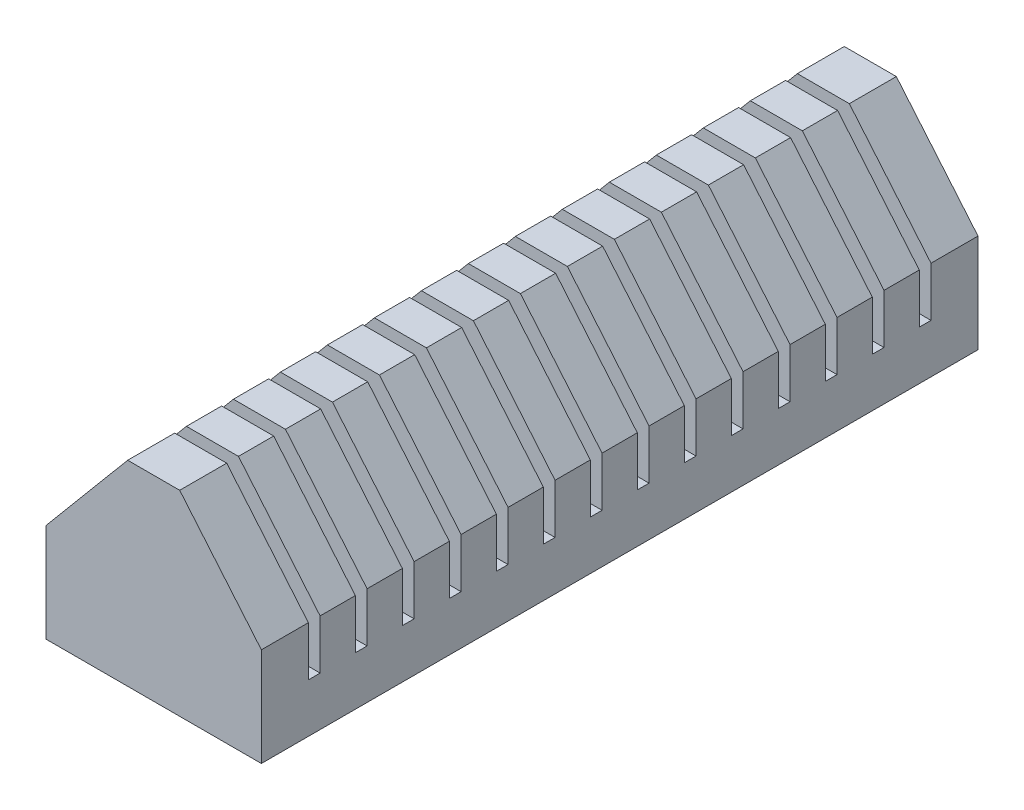
from build123d import *

# Parameters (mm, degrees)
AUFSATZ_LINEAR_AUSTRAGEN2_DEPTH      = 1.8
SCHNITT_LINEAR_AUSTRAGEN1_DEPTH      = 0.5
SCHNITT_LINEAR_AUSTRAGEN2_DEPTH      = 21.328305389
SKIZZE6_W                            = 22
SKIZZE6_H                            = 5
AUFSATZ_LINEAR_AUSTRAGEN3_DEPTH      = 1.2
LINEARES_MUSTER1_COUNT               = 15
LINEARES_MUSTER1_PITCH               = 4.8
AUFSATZ_LINEAR_AUSTRAGEN4_DEPTH      = 1.2
AUFSATZ_LINEAR_AUSTRAGEN4_DEPTH_BACK = 1.3
AUFSATZ_LINEAR_AUSTRAGEN5_DEPTH      = 1.2
AUFSATZ_LINEAR_AUSTRAGEN5_DEPTH_BACK = 0.8
AUFSATZ_LINEAR_START                 = -2.5
AUFSATZ_LINEAR_AUSTRAGEN7_DEPTH      = 2.5


with BuildPart() as part:
    # Skizze3 → Aufsatz-Linear austragen2 (new, symmetric)
    with BuildSketch(Plane.XY):
        Polygon((-11, -3), (-11, 7.057881962), (-2.657572421, 17), (2.657572421, 17), (11, 7.057881962), (11, -3), align=None)
    aufsatz_linear_austragen2 = extrude(amount=AUFSATZ_LINEAR_AUSTRAGEN2_DEPTH, both=True)

    # Skizze2 → Schnitt-Linear austragen1 (cut, symmetric)
    with BuildSketch(Plane.XY):
        Polygon((-8, 0), (8, 0), (8, 5.965971259), (0, 15.5), (-8, 5.965971259), align=None)
    schnitt_linear_austragen1 = extrude(amount=SCHNITT_LINEAR_AUSTRAGEN1_DEPTH, both=True, mode=Mode.SUBTRACT)

    # Skizze5 → Schnitt-Linear austragen2 (cut, symmetric)
    with BuildSketch(Plane.XY):
        Polygon((-0.75, 0), (0, 0.893815194), (0.75, 0), (0.75, -1.5), (-0.75, -1.5), align=None)
    schnitt_linear_austragen2 = extrude(amount=SCHNITT_LINEAR_AUSTRAGEN2_DEPTH, both=True, mode=Mode.SUBTRACT)

    # Skizze6 → Aufsatz-Linear austragen3 (add)
    with BuildSketch(Plane.XY.offset(1.8)):
        with Locations((0, -0.5)):
            Rectangle(SKIZZE6_W, SKIZZE6_H)
        Polygon((-0.75, 0), (0, 0.893815194), (0.75, 0), (0.75, -1.5), (-0.75, -1.5), align=None, mode=Mode.SUBTRACT)
    aufsatz_linear_austragen3 = extrude(amount=AUFSATZ_LINEAR_AUSTRAGEN3_DEPTH)

    # Lineares Muster1: Aufsatz-Linear austragen2, Schnitt-Linear austragen1, Schnitt-Linear austragen2, Aufsatz-Linear austragen3 ×15
    with Locations(*[(0, 0, i * LINEARES_MUSTER1_PITCH) for i in range(1, LINEARES_MUSTER1_COUNT)]):
        add(aufsatz_linear_austragen2)
        add(schnitt_linear_austragen1, mode=Mode.SUBTRACT)
        add(schnitt_linear_austragen2, mode=Mode.SUBTRACT)
        add(aufsatz_linear_austragen3)

    # Skizze8 → Aufsatz-Linear austragen4 (add, two sides: drawn at the far end of the back side and taken through both)
    with BuildSketch(Plane(origin=(0, 0, -1.8), x_dir=(-1, 0, 0), z_dir=(0, 0, -1)).offset(-AUFSATZ_LINEAR_AUSTRAGEN4_DEPTH_BACK)):
        Polygon((11, -3), (11, 7.057881962), (2.657572421, 17), (-2.657572421, 17), (-11, 7.057881962), (-11, -3), align=None)
    extrude(amount=AUFSATZ_LINEAR_AUSTRAGEN4_DEPTH + AUFSATZ_LINEAR_AUSTRAGEN4_DEPTH_BACK)

    # Skizze9 → Aufsatz-Linear austragen5 (add, two sides: drawn at the far end of the back side and taken through both)
    with BuildSketch(Plane.XY.offset(69).offset(-AUFSATZ_LINEAR_AUSTRAGEN5_DEPTH_BACK)):
        Polygon((-11, 7.057881962), (-11, 2), (11, 2), (11, 7.057881962), (2.657572421, 17), (-2.657572421, 17), align=None)
    extrude(amount=AUFSATZ_LINEAR_AUSTRAGEN5_DEPTH + AUFSATZ_LINEAR_AUSTRAGEN5_DEPTH_BACK)

    # Skizze12 → Aufsatz-Linear austragen7 (add)
    with BuildSketch(Plane.XY.offset(70.2).offset(AUFSATZ_LINEAR_START)):
        Polygon((0.75, 0), (0.75, -1.5), (-0.75, -1.5), (-0.75, 0), (0, 0.893815194), align=None)
    extrude(amount=AUFSATZ_LINEAR_AUSTRAGEN7_DEPTH)


solid = part.part
